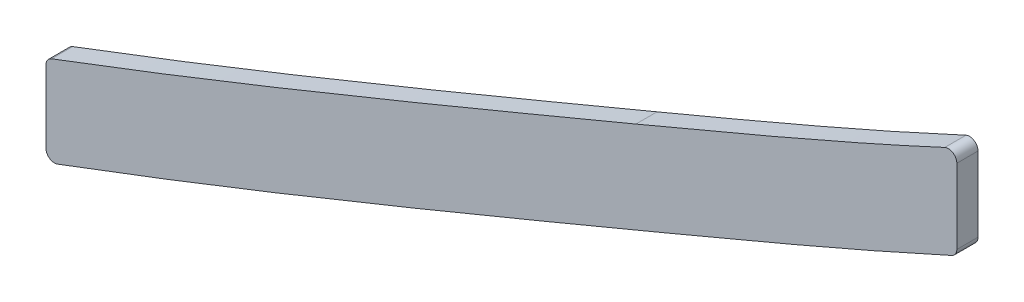
from build123d import *

# Parameters (mm, degrees)
BOSS_EXTRUDE1_DEPTH = 1.5875
FILLET1_R           = 1.27


with BuildPart() as part:
    # Sketch1 → Boss-Extrude1 (new, symmetric)
    with BuildSketch(Plane.XY):
        with BuildLine():
            add(Edge.make_bspline(
                [(103.1875, 116.775644737), (134.083206396, 128.359547048), (165.188742148, 141.378538978), (191.60780158, 152.412778165)],
                knots=[0.120408431, 0.120408431, 0.120408431, 0.120408431, 1, 1, 1, 1], degree=3))
            Line((103.1875, 116.775644737), (103.1875, 103.221766291))
            add(Edge.make_bspline(
                [(103.1875, 103.221766291), (104.836346711, 103.832888895), (110.910789744, 106.099289805), (121.438654787, 110.116470414), (134.654525061, 115.297088101), (147.709166263, 120.526352792), (160.514652982, 125.743699314), (170.90961349, 130.032834424), (179.016898276, 133.399089085), (184.983371131, 135.884243485), (189.84810323, 137.914627663), (193.677721798, 139.514035727), (195.557921278, 140.299392887), (196.502354723, 140.69384692)],
                knots=[0.078438404, 0.078438404, 0.078438404, 0.078438404, 0.125, 0.25, 0.375, 0.5, 0.625, 0.75, 0.8125, 0.875, 0.9375, 0.96875, 1, 1, 1, 1], degree=3))
            add(Edge.make_bspline(
                [(196.502354723, 140.69384692), (200.472258679, 142.351925244), (208.383523136, 145.67023209), (220.364202496, 150.772038823), (230.422608344, 155.16713119), (236.88583627, 158.07892828), (239.315563949, 159.190103703), (239.7125, 159.372089547)],
                knots=[14.817810364, 14.817810364, 14.817810364, 14.817810364, 16.034279138, 17.250747911, 18.467216684, 19.075451071, 19.194157176, 19.194157176, 19.194157176, 19.194157176], degree=3))
            Line((239.7125, 159.372089547), (239.7125, 173.372303785))
            Line((239.7125, 173.372303785), (239.230812588, 173.146496258))
            add(Edge.make_bspline(
                [(191.60780158, 152.412778165), (201.07340942, 156.366203579), (210.566735216, 160.366210114), (220.096436884, 164.442364028), (229.661309686, 168.660462928), (239.230812588, 173.146496258)],
                knots=[14.817810364, 14.817810364, 14.817810364, 14.817810364, 14.817810364, 14.817810364, 19.683685458, 19.683685458, 19.683685458, 19.683685458, 19.683685458, 19.683685458], degree=5))
        make_face()
    extrude(amount=BOSS_EXTRUDE1_DEPTH, both=True)

    # Fillet1
    fillet1_edges = [part.edges().sort_by_distance(p)[0] for p in [
        (239.7125, 159.372089547, -0.79375),
        (239.7125, 173.372303785, 0),
        (103.1875, 103.221766291, -0.79375),
        (103.1875, 116.775644737, 0.79375),
    ]]
    fillet(fillet1_edges, radius=FILLET1_R)


solid = part.part
